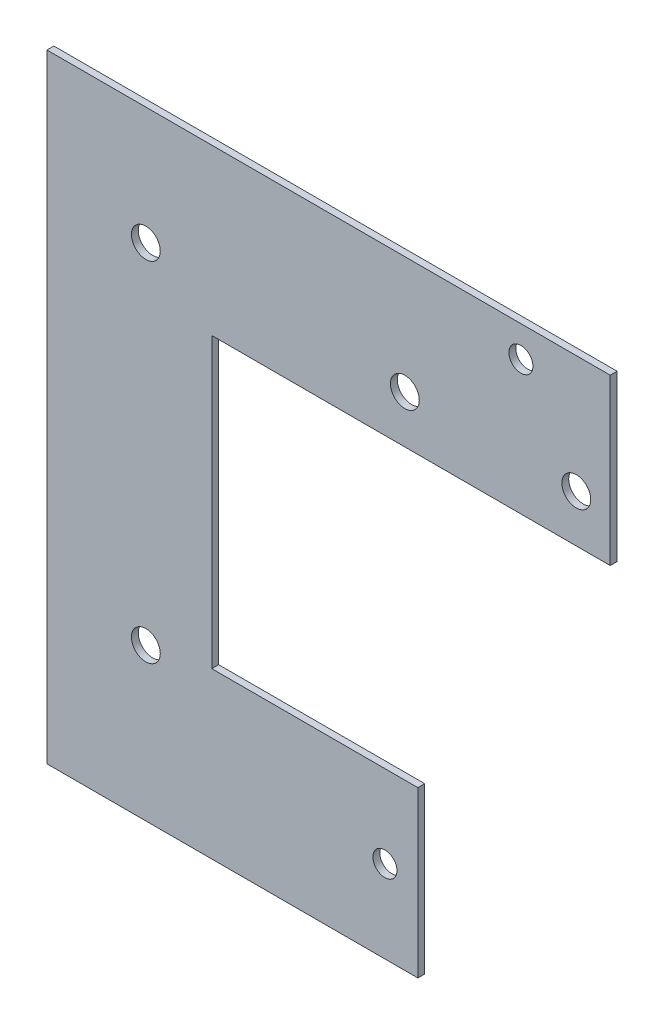
from build123d import *

# Parameters (mm, degrees)
BASE_FLANGE1_DEPTH = 1
SKETCH3_R          = 2.1
SKETCH3_R_2        = 1.75
CUT_EXTRUDE1_DEPTH = 40
SKETCH4_R          = 1.75
CUT_EXTRUDE2_DEPTH = 10


# Sheet-metal steps are written as plain solids
with BuildPart() as part:
    # Sketch1 → Base-Flange1 (new body)
    with BuildSketch(Plane.XY):
        Polygon((0, 24), (-59, 24), (-59, -66), (-35, -66), (-5, -66), (-5, -42), (-35, -42), (-35, 0), (23, 0), (23, 24), align=None)
    extrude(amount=-BASE_FLANGE1_DEPTH)

    # Sketch3 → Cut-Extrude1 (cut)
    with BuildSketch(Plane.XY):
        with Locations((-44.600589414, -43.844308668)):
            Circle(SKETCH3_R)
        with Locations((-44.600589414, 6.892572586)):
            Circle(SKETCH3_R)
        with Locations((-6.896760866, 6.942572586)):
            Circle(SKETCH3_R)
        with Locations((18.060540453, 6.892572586)):
            Circle(SKETCH3_R)
        with Locations((10.002152137, 19.5)):
            Circle(SKETCH3_R_2)
    extrude(amount=-CUT_EXTRUDE1_DEPTH, mode=Mode.SUBTRACT)

    # Sketch4 → Cut-Extrude2 (cut)
    with BuildSketch(Plane.XY):
        with Locations((-9.791680506, -54)):
            Circle(SKETCH4_R)
    extrude(amount=-CUT_EXTRUDE2_DEPTH, mode=Mode.SUBTRACT)


solid = part.part
